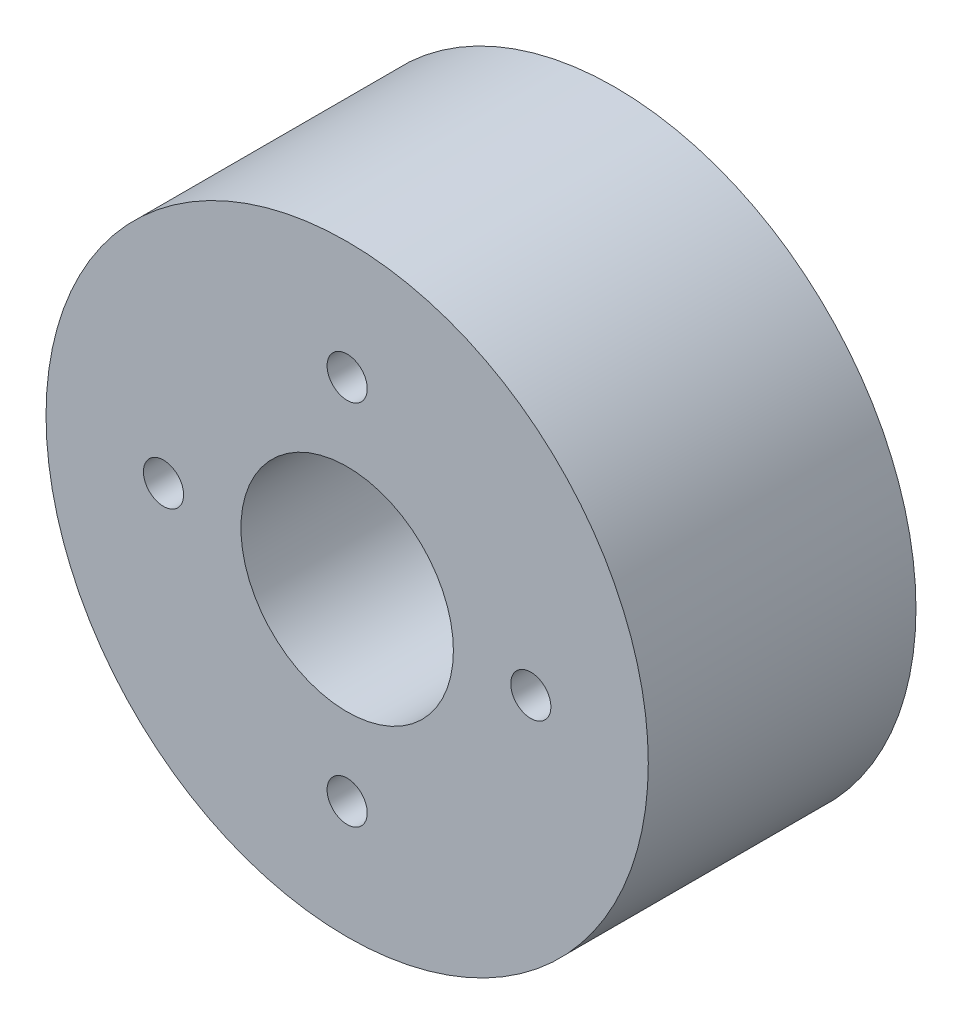
from build123d import *

# Parameters (mm, degrees)
SKETCH1_R           = 22.5
SKETCH1_R_2         = 7.9375
BOSS_EXTRUDE1_DEPTH = 20
SKETCH2_R           = 1.5
CUT_EXTRUDE1_DEPTH  = 38.583240946
SKETCH3_R           = 2.75
CUT_EXTRUDE2_DEPTH  = 13


with BuildPart() as part:
    # Sketch1 → Boss-Extrude1 (new body)
    with BuildSketch(Plane.XY):
        Circle(SKETCH1_R)
        Circle(SKETCH1_R_2, mode=Mode.SUBTRACT)
    extrude(amount=BOSS_EXTRUDE1_DEPTH)

    # Sketch2 → Cut-Extrude1 (cut, through all)
    with BuildSketch(Plane.XY.offset(20)):
        with Locations((0, 13.72092009)):
            Circle(SKETCH2_R)
        with Locations((13.72092009, 0)):
            Circle(SKETCH2_R)
        with Locations((0, -13.72092009)):
            Circle(SKETCH2_R)
        with Locations((-13.72092009, 0)):
            Circle(SKETCH2_R)
    extrude(amount=-CUT_EXTRUDE1_DEPTH, mode=Mode.SUBTRACT)

    # Sketch3 → Cut-Extrude2 (cut)
    with BuildSketch(Plane.XY):
        with Locations((0, 13.72092009)):
            Circle(SKETCH3_R)
        with Locations((13.72092009, 0)):
            Circle(SKETCH3_R)
        with Locations((0, -13.72092009)):
            Circle(SKETCH3_R)
        with Locations((-13.72092009, 0)):
            Circle(SKETCH3_R)
    extrude(amount=CUT_EXTRUDE2_DEPTH, mode=Mode.SUBTRACT)


solid = part.part
